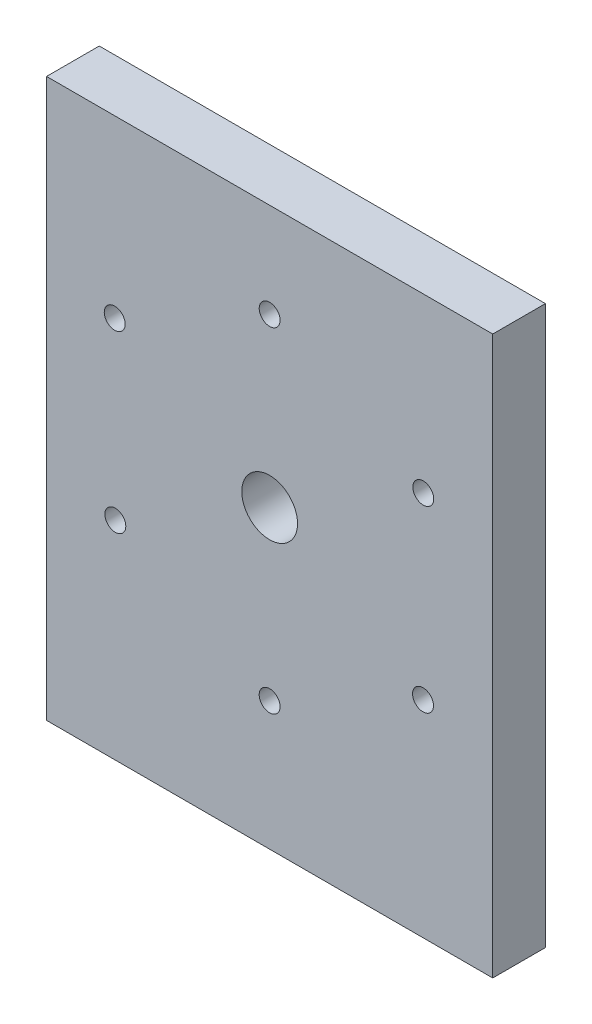
from build123d import *

# Parameters (mm, degrees)
SKETCH1_W                  = 101.6
SKETCH1_H                  = 127
SKETCH1_R                  = 6.35
BOSS_EXTRUDE1_DEPTH        = 12.0000014
SKETCH2_R                  = 2.38125
CUT_EXTRUDE1_DEPTH         = 138.308557758
SKETCH3_R                  = 1.27
CUT_EXTRUDE2_DEPTH         = 12.7
F_10_32_TAPPED_HOLE3_D     = 4.0386
F_10_32_TAPPED_HOLE3_DEPTH = 12.7
F_10_32_TAPPED_HOLE3_TIP   = 1.213317848


with BuildPart() as part:
    # Sketch1 → Boss-Extrude1 (new body)
    with BuildSketch(Plane.XY):
        with Locations((0, 63.5)):
            Rectangle(SKETCH1_W, SKETCH1_H)
        with Locations((0, 67.3749986)):
            Circle(SKETCH1_R, mode=Mode.SUBTRACT)
    extrude(amount=BOSS_EXTRUDE1_DEPTH)

    # Sketch2 → Cut-Extrude1 (cut, through all)
    with BuildSketch(Plane(origin=(0, 0, 0), x_dir=(-1, 0, 0), z_dir=(0, 0, -1))):
        with Locations((0, 105.4749986)):
            Circle(SKETCH2_R)
        with Locations((0, 29.2749986)):
            Circle(SKETCH2_R)
        with Locations((-34.984744944, 87.73401586)):
            Circle(SKETCH2_R)
        with Locations((-34.925247814, 46.929761369)):
            Circle(SKETCH2_R)
        with Locations((35.14460697, 47.299336584)):
            Circle(SKETCH2_R)
        with Locations((35.285771816, 87.077162318)):
            Circle(SKETCH2_R)
    extrude(amount=-CUT_EXTRUDE1_DEPTH, mode=Mode.SUBTRACT)

    # Sketch3 → Cut-Extrude2 (cut)
    with BuildSketch(Plane.XZ):
        with Locations((31.75, 6.0000007)):
            Circle(SKETCH3_R)
        with Locations((0, 6.0000007)):
            Circle(SKETCH3_R)
        with Locations((-31.75, 6.0000007)):
            Circle(SKETCH3_R)
    extrude(amount=-CUT_EXTRUDE2_DEPTH, mode=Mode.SUBTRACT)

    # #10-32 Tapped Hole3
    with Locations(Plane(origin=(0, 0, 0), x_dir=(-1, 0, 0), z_dir=(0, -1, 0))):
        with Locations((-31.75, -6.0000007), (0, -6.0000007), (31.75, -6.0000007)):
            Hole(F_10_32_TAPPED_HOLE3_D / 2, depth=F_10_32_TAPPED_HOLE3_DEPTH)
            with Locations((0, 0, -(F_10_32_TAPPED_HOLE3_DEPTH + F_10_32_TAPPED_HOLE3_TIP / 2))):  # 118° drill point
                Cone(0, F_10_32_TAPPED_HOLE3_D / 2, F_10_32_TAPPED_HOLE3_TIP, mode=Mode.SUBTRACT)


solid = part.part
